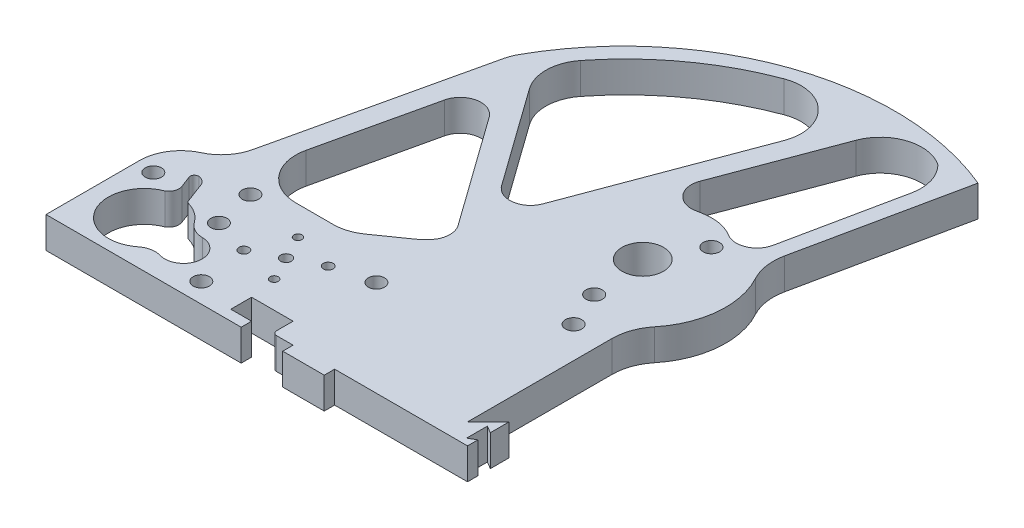
from build123d import *

# Parameters (mm, degrees)
SKETCH1_R                = 6.35
SKETCH1_W                = 139.7
SKETCH1_H                = 38.1
BOSS_EXTRUDE1_DEPTH      = 9.525
CUT_EXTRUDE4_DEPTH       = 106.62050594
CUT_EXTRUDE4_DEPTH_BACK  = 106.62050594
SKETCH5_W                = 20.32
SKETCH5_H                = 77.381530754
FILLET9_R                = 12.7
BOSS_EXTRUDE4_DEPTH      = 9.525
CUT_EXTRUDE3_DEPTH       = 153.280394257
CUT_EXTRUDE3_DEPTH_BACK  = 153.280394257
SKETCH4_R                = 10.9728
FILLET13_R               = 12.7
FILLET14_R               = 6.35
CUT_EXTRUDE5_DEPTH       = 153.280394397
CUT_EXTRUDE5_DEPTH_BACK  = 153.280394397
SKETCH7_W                = 12.7
SKETCH7_H                = 6.35
FILLET15_R               = 1.27
SKETCH8_W                = 59.69
SKETCH8_H                = 3.175
SKETCH8_W_2              = 12.7
BOSS_EXTRUDE5_DEPTH      = 9.525
SKETCH9_R                = 14.2875
CUT_EXTRUDE6_DEPTH       = 5.08
CUT_EXTRUDE7_DEPTH       = 153.067088129
CUT_EXTRUDE7_DEPTH_BACK  = 153.067088129
SKETCH10_R               = 1.651
BOSS_EXTRUDE6_START      = -9.525
BOSS_EXTRUDE6_DEPTH      = 9.525
FILLET16_R               = 15.24
SKETCH12_R               = 1.5
SKETCH12_R_2             = 1.25
CUT_EXTRUDE8_DEPTH       = 4.445
CUT_EXTRUDE10_DEPTH      = 153.280394397
CUT_EXTRUDE10_DEPTH_BACK = 153.280394397
SKETCH13_R               = 2.4892
SKETCH13_R_2             = 5.715
FILLET18_R               = 6.35
CUT_EXTRUDE11_DEPTH      = 153.280394397
CUT_EXTRUDE11_DEPTH_BACK = 153.280394397
SKETCH15_R               = 2.5
BOSS_EXTRUDE7_DEPTH      = 9.525
CUT_EXTRUDE12_DEPTH      = 153.280394397
CUT_EXTRUDE12_DEPTH_BACK = 153.280394397
SKETCH19_R               = 2.4892


with BuildPart() as part:
    # Sketch1 → Boss-Extrude1 (new body)
    # profile 1 of 2: a face of its own
    with BuildSketch(Plane(origin=(0, 0, 0), x_dir=(1, 0, 0), z_dir=(0, 1, 0))):
        with BuildLine():
            Line((-2.585114067, 30.705073187), (-19.230283607, 19.05))
            Line((-19.230283607, 19.05), (65.876676898, 19.05))
            Line((65.876676898, 19.05), (45.762611627, 67.384672451))
            Line((45.762611627, 67.384672451), (47.126806193, 73.586403918))
            ThreePointArc((47.126806193, 73.586403918), (27.684344017, 77.91367928), (13.031924758, 64.421412702))
            Line((13.031924758, 64.421412702), (0.786820794, 49.82826606))
            Line((0.786820794, 49.82826606), (-2.585114067, 30.705073187))
        make_face()
        with Locations(Location((33.265795842, 57.15, 0), (0, 0, 90))):
            Circle(SKETCH1_R, mode=Mode.SUBTRACT)
    # profile 2 of 2: a face of its own
    with BuildSketch(Plane(origin=(0, 0, 0), x_dir=(1, 0, 0), z_dir=(0, 1, 0))):
        Rectangle(SKETCH1_W, SKETCH1_H)
    extrude(amount=BOSS_EXTRUDE1_DEPTH)

    # Sketch5 → Cut-Extrude4 (cut, two sides: drawn at the far end of the back side and taken through both)
    with BuildSketch(Plane(origin=(0, 9.525, 0), x_dir=(1, 0, 0), z_dir=(0, 1, 0)).offset(-CUT_EXTRUDE4_DEPTH_BACK)):
        with Locations((59.69, 19.640765377)):
            Rectangle(SKETCH5_W, SKETCH5_H)
    extrude(amount=CUT_EXTRUDE4_DEPTH + CUT_EXTRUDE4_DEPTH_BACK, mode=Mode.SUBTRACT)

    # Fillet9
    fillet9_edges = [part.edges().sort_by_distance(p)[0] for p in [
        (-69.85, 4.7625, -19.05),
    ]]
    fillet(fillet9_edges, radius=FILLET9_R)

    # Sketch6 → Boss-Extrude4 (add)
    with BuildSketch(Plane(origin=(0, 9.525, 0), x_dir=(1, 0, 0), z_dir=(0, 1, 0))):
        with BuildLine():
            Line((-40.820324649, 90.757686087), (-57.15, 19.05))
            Line((-57.15, 19.05), (-50.637428899, 19.05))
            Line((-50.637428899, 19.05), (-36.112276852, 82.833573217))
            Line((-36.112276852, 82.833573217), (-1.836902529, 34.948391683))
            Line((-1.836902529, 34.948391683), (-0.1716456, 44.392533029))
            Line((-0.1716456, 44.392533029), (-34.470324649, 92.310272954))
            ThreePointArc((-34.470324649, 92.310272954), (-6.367424053, 120.099806777), (31.427854219, 131.656110351))
            Line((31.427854219, 131.656110351), (0.786820794, 49.82826606))
            Line((0.786820794, 49.82826606), (13.031924758, 64.421412702))
            Line((13.031924758, 64.421412702), (38.768247431, 133.151072535))
            ThreePointArc((38.768247431, 133.151072535), (49.726444557, 129.989338268), (58.105148392, 122.251381827))
            Line((58.105148392, 122.251381827), (46.378042741, 65.905773934))
            Line((46.378042741, 65.905773934), (49.53, 58.331530754))
            Line((49.53, 58.331530754), (64.336089791, 128.600275766))
            ThreePointArc((64.336089791, 128.600275766), (4.413649104, 130.087025535), (-40.820324649, 90.757686087))
        make_face()
    extrude(amount=-BOSS_EXTRUDE4_DEPTH)

    # Sketch4 → Cut-Extrude3 (cut, two sides: drawn at the far end of the back side and taken through both)
    with BuildSketch(Plane(origin=(0, 0, 0), x_dir=(-1, 0, 0), z_dir=(0, -1, 0)).offset(-CUT_EXTRUDE3_DEPTH_BACK)):
        with Locations(Location((53.975, -8.0518, 0), (0, 0, 90))):
            Circle(SKETCH4_R)
    extrude(amount=CUT_EXTRUDE3_DEPTH + CUT_EXTRUDE3_DEPTH_BACK, mode=Mode.SUBTRACT)

    # Fillet13
    # the kernel refuses this fillet: 12.7 mm, written as the material it adds along each edge
    with BuildSketch(Plane(origin=(-57.15, 0, -19.05), x_dir=(-0.976607789728772, 0, 0.2150284284486181), z_dir=(0, 1, 0))) as fillet13_piece_1:
        with BuildLine():
            CenterArc((8.192583124, -12.40291893), FILLET13_R, 102.417195144, 52.336673181)
            Line((-3.294362955, -6.986271462), (0, 0))
            ThreePointArc((0, 0), (2.730861041, -0.29708107), (5.461722083, 0))
        make_face()
    extrude(amount=9.525)
    with BuildSketch(Plane(origin=(-50.637428899, 9.525, -19.05), x_dir=(0.22204095655633652, 0, -0.9750373395986162), z_dir=(0, -1, 0))) as fillet13_piece_2:
        with BuildLine():
            CenterArc((FILLET13_R * 1.25332734135, FILLET13_R), FILLET13_R, 167.17106347, 102.82893653)
            Line((FILLET13_R * 0.278290001752, FILLET13_R * 1.22204095656), (0, 0))
            Line((0, 0), (FILLET13_R * 1.25332734135, 0))
        make_face()
    extrude(amount=9.525)
    with BuildSketch(Plane(origin=(-19.230283607, 0, -19.05), x_dir=(0.8191520442889918, 0, -0.5735764363510462), z_dir=(0, 1, 0))) as fillet13_piece_3:
        with BuildLine():
            CenterArc((FILLET13_R * 0.315298788879, FILLET13_R), FILLET13_R, 235, 35)
            Line((-FILLET13_R * 0.258277647472, FILLET13_R * 0.180847955711), (0, 0))
            Line((0, 0), (FILLET13_R * 0.315298788879, 0))
        make_face()
    extrude(amount=9.525)
    with BuildSketch(Plane(origin=(-2.585114067, 0, -30.705073187), x_dir=(0.17364817766692484, 0, -0.9848077530122089), z_dir=(0, 1, 0))) as fillet13_piece_4:
        with BuildLine():
            CenterArc((5.299189821, 12.661322422), FILLET13_R, 225, 40.527239041)
            Line((-3.681066301, 3.681066301), (0, 0))
            Line((0, 0), (4.308778524, 0))
        make_face()
    extrude(amount=9.525)
    with BuildSketch(Plane(origin=(-0.1716456, 9.525, -44.392533029), x_dir=(0.17364817766692364, 0, -0.9848077530122092), z_dir=(0, -1, 0))) as fillet13_piece_5:
        with BuildLine():
            CenterArc((18.211827751, -0.443902553), FILLET13_R, 177.996935086, 46.408641112)
            Line((9.138889548, -9.330510025), (0, 0))
            Line((0, 0), (5.519587975, 0))
        make_face()
    extrude(amount=9.525)
    with BuildSketch(Plane(origin=(-34.470324649, 9.525, -92.310272954), x_dir=(0.582043833980417, 0, 0.8131574111605802), z_dir=(0, -1, 0))) as fillet13_piece_6:
        with BuildLine():
            CenterArc((8.943849896, -12.7), FILLET13_R, 90, 73.823338331)
            ThreePointArc((-3.25332215, -9.161780942), (-1.76154416, -4.532993874), (0, 0))
            Line((0, 0), (8.943849896, 0))
        make_face()
    extrude(amount=9.525)
    with BuildSketch(Plane(origin=(31.427854219, 9.525, -131.656110351), x_dir=(-0.35067782252306107, 0, 0.9364961637884506), z_dir=(0, -1, 0))) as fillet13_piece_7:
        with BuildLine():
            CenterArc((22.910577069, 12.7), FILLET13_R, 138.970878113, 131.029121887)
            ThreePointArc((13.330001541, 21.036820291), (5.867776411, 11.023572133), (0, 0))
            Line((0, 0), (22.910577069, 0))
        make_face()
    extrude(amount=9.525)
    with BuildSketch(Plane(origin=(38.768247431, 9.525, -133.151072535), x_dir=(0.9114378000140282, 0, 0.4114378892440367), z_dir=(0, -1, 0))) as fillet13_piece_8:
        with BuildLine():
            CenterArc((13.505287969, 11.815048757), FILLET13_R, 176.233586555, 115.281848771)
            Line((0.83271811, 12.649298827), (0, 0))
            ThreePointArc((0, 0), (9.08151833, -1.725447521), (18.163036659, 0))
        make_face()
    extrude(amount=9.525)
    with BuildSketch(Plane(origin=(58.105148392, 9.525, -122.251381827), x_dir=(-0.20376170284526773, 0, 0.9790205148277521), z_dir=(0, -1, 0))) as fillet13_piece_9:
        with BuildLine():
            CenterArc((6.572505314, 12.7), FILLET13_R, 202.357643181, 67.642356819)
            ThreePointArc((-5.172803851, 7.869087807), (-2.96392391, 3.686376997), (0, 0))
            Line((0, 0), (6.572505314, 0))
        make_face()
    extrude(amount=9.525)
    with BuildSketch(Plane(origin=(46.378042741, 9.525, -65.905773934), x_dir=(-0.3842022467121058, 0, -0.9232489553860163), z_dir=(0, -1, 0))) as fillet13_piece_10:
        with BuildLine():
            CenterArc((12.142765771, -7.083707791), FILLET13_R, 124.351243604, 21.746881653)
            Line((4.976604581, 3.401335546), (0, 0))
            Line((0, 0), (1.601841527, 0))
        make_face()
    extrude(amount=9.525)
    with BuildSketch(Plane(origin=(49.53, 9.525, -58.331530754), x_dir=(0, 0, 1), z_dir=(0, -1, 0))) as fillet13_piece_11:
        with BuildLine():
            CenterArc((FILLET13_R * 0.104209219527, -FILLET13_R), FILLET13_R, 90, 11.898549943)
            Line((-FILLET13_R * 0.101970201439, -FILLET13_R * 0.0214857965414), (0, 0))
            Line((0, 0), (FILLET13_R * 0.104209219527, 0))
        make_face()
    extrude(amount=9.525)
    # the kernel refuses this fillet: 12.7 mm, written as the material it takes off along each edge
    with BuildSketch(Plane(origin=(47.126806193, -37.591362954, -73.586403918), x_dir=(-0.21483378988048846, 0, 0.9766506246993272), z_dir=(0, 1, 0))) as fillet13_2_piece_1:
        with BuildLine():
            CenterArc((10.462171267, -12.015824877), FILLET13_R, 108.892466087, 84.306815738)
            ThreePointArc((-1.902317149, -14.915725945), (-2.297569948, -7.286144783), (0, 0))
            Line((0, 0), (6.35, 0))
        make_face()
    extrude(amount=84.707725907, mode=Mode.SUBTRACT)
    with BuildSketch(Plane(origin=(-40.820324649, 14.244767821, -90.757686087), x_dir=(-0.22204095655633999, 0, 0.9750373395986153), z_dir=(0, -1, 0))) as fillet13_2_piece_2:
        with BuildLine():
            CenterArc((1.737149391, -12.7), FILLET13_R, 90, 16.257709838)
            ThreePointArc((-1.818319721, -0.50784517), (-0.91060685, -0.248741695), (0, 0))
            Line((0, 0), (1.737149391, 0))
        make_face()
    extrude(amount=18.964535642, mode=Mode.SUBTRACT)

    # Fillet14
    fillet14_edges = [part.edges().sort_by_distance(p)[0] for p in [
        (0.786820794, 4.7625, -49.82826606),
        (-1.836902529, 4.7625, -34.948391683),
        (-36.112276852, 4.7625, -82.833573217),
        (13.23245619, 4.7625, -64.956938204),
        (45.762611627, 4.7625, -67.384672451),
    ]]
    fillet(fillet14_edges, radius=FILLET14_R)

    # Sketch7 → Cut-Extrude5 (cut, two sides: drawn at the far end of the back side and taken through both)
    with BuildSketch(Plane(origin=(0, 0, 0), x_dir=(-1, 0, 0), z_dir=(0, -1, 0)).offset(-CUT_EXTRUDE5_DEPTH_BACK)):
        with Locations((10.16, -15.875)):
            Rectangle(SKETCH7_W, SKETCH7_H)
    extrude(amount=CUT_EXTRUDE5_DEPTH + CUT_EXTRUDE5_DEPTH_BACK, mode=Mode.SUBTRACT)

    # Fillet15
    fillet15_edges = [part.edges().sort_by_distance(p)[0] for p in [
        (-3.81, 4.7625, 19.05),
    ]]
    fillet(fillet15_edges, radius=FILLET15_R)

    # Sketch8 → Boss-Extrude5 (add)
    with BuildSketch(Plane(origin=(0, 9.525, 0), x_dir=(1, 0, 0), z_dir=(0, 1, 0))):
        with Locations((-40.005, -20.6375)):
            Rectangle(SKETCH8_W, SKETCH8_H)
        with Locations((8.89, -20.6375)):
            Rectangle(SKETCH8_W_2, SKETCH8_H)
    extrude(amount=-BOSS_EXTRUDE5_DEPTH)

    # Sketch9 → Cut-Extrude6 (cut)
    with BuildSketch(Plane.XZ):
        with Locations(Location((-21.59, -2.921, 0), (0, 0, 270))):
            Circle(SKETCH9_R)
    extrude(amount=-CUT_EXTRUDE6_DEPTH, mode=Mode.SUBTRACT)

    # Sketch10 → Cut-Extrude7 (cut, two sides: drawn at the far end of the back side and taken through both)
    with BuildSketch(Plane(origin=(0, 5.08, 0), x_dir=(-1, 0, 0), z_dir=(0, -1, 0)).offset(-CUT_EXTRUDE7_DEPTH_BACK)):
        with Locations(Location((21.59, 2.921, 0), (0, 0, 90))):
            Circle(SKETCH10_R)
    extrude(amount=CUT_EXTRUDE7_DEPTH + CUT_EXTRUDE7_DEPTH_BACK, mode=Mode.SUBTRACT)

    # Sketch11 → Boss-Extrude6 (add)
    with BuildSketch(Plane(origin=(0, 9.525, 0), x_dir=(1, 0, 0), z_dir=(0, 1, 0)).offset(BOSS_EXTRUDE6_START)):
        with BuildLine():
            ThreePointArc((58.665795842, 57.15), (57.133538631, 65.838547299), (52.721634096, 73.478819853))
            Line((52.721634096, 73.478819853), (49.802869616, 59.626552312))
            ThreePointArc((49.802869616, 59.626552312), (49.598401608, 58.324402676), (49.53, 57.008073666))
            Line((49.53, 57.008073666), (49.53, 37.640113709))
            ThreePointArc((49.53, 37.640113709), (56.268738975, 46.378528086), (58.665795842, 57.15))
        make_face()
    extrude(amount=BOSS_EXTRUDE6_DEPTH)

    # Fillet16
    fillet16_edges = [part.edges().sort_by_distance(p)[0] for p in [
        (49.53, 4.7625, -37.640113709),
        (52.721634096, 4.7625, -73.478819853),
    ]]
    fillet(fillet16_edges, radius=FILLET16_R)

    # Sketch12 → Cut-Extrude8 (cut)
    with BuildSketch(Plane.XZ.offset(-5.08)):
        with Locations(Location((-13.019543441, -7.246190674, 0), (0, 0, 270))):
            Circle(SKETCH12_R)
        with Locations(Location((-25.306960736, -10.286236106, 0), (0, 0, 270))):
            Circle(SKETCH12_R_2)
        with Locations(Location((-30.160456559, 1.404190674, 0), (0, 0, 270))):
            Circle(SKETCH12_R)
        with Locations(Location((-17.873039264, 4.444236106, 0), (0, 0, 270))):
            Circle(SKETCH12_R_2)
    extrude(amount=-CUT_EXTRUDE8_DEPTH, mode=Mode.SUBTRACT)

    # Sketch13 → Cut-Extrude10 (cut, two sides: drawn at the far end of the back side and taken through both)
    with BuildSketch(Plane(origin=(0, 0, 0), x_dir=(-1, 0, 0), z_dir=(0, -1, 0)).offset(-CUT_EXTRUDE10_DEPTH_BACK)):
        with Locations(Location((28.399421405, -16.1925, 0), (0, 0, 90))):
            Circle(SKETCH13_R)
        with Locations(Location((41.169058479, 1.967171756, 0), (0, 0, 90))):
            Circle(SKETCH13_R)
        with Locations(Location((64.5668, 5.3086, 0), (0, 0, 90))):
            Circle(SKETCH13_R)
        with Locations((39.915018784, -10.122382764)):
            Circle(SKETCH13_R_2)
        with BuildLine():
            Line((51.674055679, 3.142720043), (53.974558887, 9.229630913))
            ThreePointArc((53.974558887, 9.229630913), (54.954784391, 10.581337042), (56.485302046, 11.24877034))
            ThreePointArc((56.485302046, 11.24877034), (57.658662148, 10.788019044), (57.856974373, 9.543134332))
            Line((57.856974373, 9.543134332), (56.538847729, 6.055497642))
            ThreePointArc((56.538847729, 6.055497642), (56.592853979, 3.676906453), (58.284268241, 2.003666927))
            Line((58.284268241, 2.003666927), (50.856006778, 2.376783236))
            ThreePointArc((50.856006778, 2.376783236), (51.354082414, 2.664641672), (51.674055679, 3.142720043))
        make_face()
    extrude(amount=CUT_EXTRUDE10_DEPTH + CUT_EXTRUDE10_DEPTH_BACK, mode=Mode.SUBTRACT)

    # Fillet18
    fillet18_edges = [part.edges().sort_by_distance(p)[0] for p in [
        (-43.299001495, 4.7625, 5.516963563),
        (-44.483000869, 4.7625, 13.556733455),
    ]]
    fillet(fillet18_edges, radius=FILLET18_R)

    # Sketch15 → Cut-Extrude11 (cut, two sides: drawn at the far end of the back side and taken through both)
    with BuildSketch(Plane(origin=(0, 9.525, 0), x_dir=(1, 0, 0), z_dir=(0, 1, 0)).offset(-CUT_EXTRUDE11_DEPTH_BACK)):
        with Locations(Location((40.5384, 70.866, 0), (0, 0, 270))):
            Circle(SKETCH15_R)
        with Locations(Location((35.179, 40.386, 0), (0, 0, 270))):
            Circle(SKETCH15_R)
        with Locations(Location((39.9034, 29.3624, 0), (0, 0, 270))):
            Circle(SKETCH15_R)
    extrude(amount=CUT_EXTRUDE11_DEPTH + CUT_EXTRUDE11_DEPTH_BACK, mode=Mode.SUBTRACT)

    # Sketch16 → Boss-Extrude7 (add)
    with BuildSketch(Plane(origin=(0, 9.525, 0), x_dir=(1, 0, 0), z_dir=(0, 1, 0))):
        Polygon((55.88, -6.35), (49.53, -12.7), (49.53, -19.05), (55.88, -19.05), (55.88, -15.875), (53.680295474, -17.145), (53.680295474, -10.795), (55.88, -12.065), align=None)
    extrude(amount=-BOSS_EXTRUDE7_DEPTH)

    # Sketch19 → Cut-Extrude12 (cut, two sides: drawn at the far end of the back side and taken through both)
    with BuildSketch(Plane(origin=(0, 9.525, 0), x_dir=(-1, 0, 0), z_dir=(0, 1, 0)).offset(-CUT_EXTRUDE12_DEPTH_BACK)):
        with Locations(Location((43.8658, -14.3002, 0), (0, 0, 90))):
            Circle(SKETCH19_R)
        with Locations(Location((1.3208, -10.287, 0), (0, 0, 90))):
            Circle(SKETCH19_R)
    extrude(amount=CUT_EXTRUDE12_DEPTH + CUT_EXTRUDE12_DEPTH_BACK, mode=Mode.SUBTRACT)


solid = part.part
